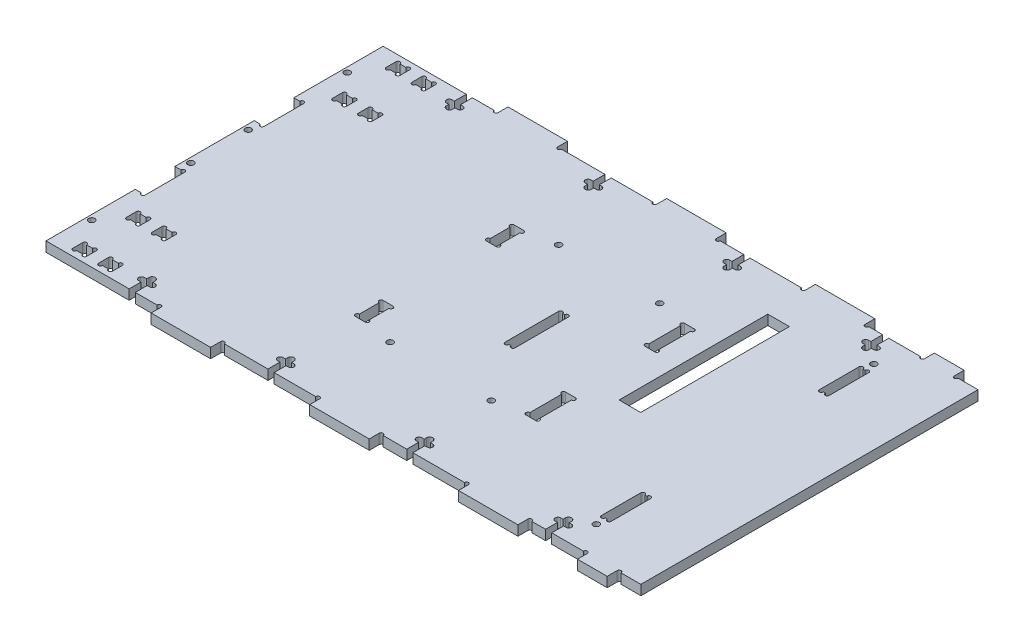
from build123d import *

# Parameters (mm, degrees)
SKETCH_1_W           = 300
SKETCH_1_H           = 170
EXTRUDE_1_DEPTH      = 5
SKETCH_2_W           = 5
SKETCH_2_H           = 27
SKETCH_2_H_2         = 20
CUT_EXTRUDE_1_DEPTH  = 10
SKETCH_3_R           = 1.55
CUT_EXTRUDE_2_DEPTH  = 10
SKETCH_4_W           = 5
SKETCH_4_H           = 20
CUT_EXTRUDE_3_DEPTH  = 5
SKETCH_5_R           = 1
CUT_EXTRUDE_4_DEPTH  = 10
SKETCH_8_W           = 30
SKETCH_8_H           = 5
SKETCH_8_W_2         = 15
EXTRUDE_2_DEPTH      = 5
SKETCH_9_R           = 1
CUT_EXTRUDE_6_DEPTH  = 5
SKETCH_13_W          = 7
SKETCH_13_H          = 5
CUT_EXTRUDE_9_DEPTH  = 10
SKETCH_14_R          = 1
CUT_EXTRUDE_10_DEPTH = 10
SKETCH_15_W          = 5
SKETCH_15_H          = 14
SKETCH_15_H_2        = 20
CUT_EXTRUDE_11_DEPTH = 10
SKETCH_16_R          = 1
CUT_EXTRUDE_12_DEPTH = 10
SKETCH_17_W          = 10.9
SKETCH_17_H          = 75
CUT_EXTRUDE_13_DEPTH = 10
CUT_EXTRUDE_5_DEPTH  = 10


with BuildPart() as part:
    # 스케치1 → 보스-돌출1 (new body)
    with BuildSketch(Plane(origin=(0, 0, 0), x_dir=(1, 0, 0), z_dir=(0, 1, 0))):
        with Locations((150, 85)):
            Rectangle(SKETCH_1_W, SKETCH_1_H)
    extrude(amount=EXTRUDE_1_DEPTH)

    # 스케치2 → 컷-돌출1 (cut)
    with BuildSketch(Plane.XZ):
        with Locations((162.5, -85)):
            Rectangle(SKETCH_2_W, SKETCH_2_H)
        with Locations((262.5, -30)):
            Rectangle(SKETCH_2_W, SKETCH_2_H_2)
        with Locations((262.5, -140)):
            Rectangle(SKETCH_2_W, SKETCH_2_H_2)
    extrude(amount=-CUT_EXTRUDE_1_DEPTH, mode=Mode.SUBTRACT)

    # 스케치3 → 컷-돌출2 (cut)
    with BuildSketch(Plane(origin=(0, 5, 0), x_dir=(1, 0, 0), z_dir=(0, 1, 0))):
        with Locations((131, 127.5)):
            Circle(SKETCH_3_R)
        with Locations((182, 127.5)):
            Circle(SKETCH_3_R)
        with Locations((182, 42.5)):
            Circle(SKETCH_3_R)
        with Locations((131, 42.5)):
            Circle(SKETCH_3_R)
        with Locations((2.5, 70.55)):
            Circle(SKETCH_3_R)
        with Locations((2.5, 20.55)):
            Circle(SKETCH_3_R)
        with Locations((2.5, 99.45)):
            Circle(SKETCH_3_R)
        with Locations((2.5, 149.45)):
            Circle(SKETCH_3_R)
        with Locations((262.5, 155)):
            Circle(SKETCH_3_R)
        with Locations((262.5, 15)):
            Circle(SKETCH_3_R)
    extrude(amount=-CUT_EXTRUDE_2_DEPTH, mode=Mode.SUBTRACT)

    # 스케치4 → 컷-돌출3 (cut)
    with BuildSketch(Plane.XZ):
        with Locations((2.5, -115)):
            Rectangle(SKETCH_4_W, SKETCH_4_H)
        with Locations((2.5, -55)):
            Rectangle(SKETCH_4_W, SKETCH_4_H)
    extrude(amount=-CUT_EXTRUDE_3_DEPTH, mode=Mode.SUBTRACT)

    # 스케치5 → 컷-돌출4 (cut)
    with BuildSketch(Plane.XZ):
        with Locations((4, -45)):
            Circle(SKETCH_5_R)
        with Locations((4, -65)):
            Circle(SKETCH_5_R)
        with Locations((4, -105)):
            Circle(SKETCH_5_R)
        with Locations((4, -125)):
            Circle(SKETCH_5_R)
        with Locations((164, -98.5)):
            Circle(SKETCH_5_R)
        with Locations((161, -98.5)):
            Circle(SKETCH_5_R)
        with Locations((164, -71.5)):
            Circle(SKETCH_5_R)
        with Locations((161, -71.5)):
            Circle(SKETCH_5_R)
        with Locations((264, -20)):
            Circle(SKETCH_5_R)
        with Locations((261, -20)):
            Circle(SKETCH_5_R)
        with Locations((264, -40)):
            Circle(SKETCH_5_R)
        with Locations((261, -40)):
            Circle(SKETCH_5_R)
        with Locations((264, -130)):
            Circle(SKETCH_5_R)
        with Locations((261, -130)):
            Circle(SKETCH_5_R)
        with Locations((264, -150)):
            Circle(SKETCH_5_R)
        with Locations((261, -150)):
            Circle(SKETCH_5_R)
    extrude(amount=-CUT_EXTRUDE_4_DEPTH, mode=Mode.SUBTRACT)

    # 스케치8 → 보스-돌출2 (add)
    with BuildSketch(Plane.XZ):
        with Locations((73, 2.5)):
            Rectangle(SKETCH_8_W, SKETCH_8_H)
        with Locations((153, 2.5)):
            Rectangle(SKETCH_8_W, SKETCH_8_H)
        with Locations((228, 2.5)):
            Rectangle(SKETCH_8_W, SKETCH_8_H)
        with Locations((280.5, 2.5)):
            Rectangle(SKETCH_8_W_2, SKETCH_8_H)
        with Locations((280.5, -172.5)):
            Rectangle(SKETCH_8_W_2, SKETCH_8_H)
        with Locations((228, -172.5)):
            Rectangle(SKETCH_8_W, SKETCH_8_H)
        with Locations((153, -172.5)):
            Rectangle(SKETCH_8_W, SKETCH_8_H)
        with Locations((73, -172.5)):
            Rectangle(SKETCH_8_W, SKETCH_8_H)
    extrude(amount=-EXTRUDE_2_DEPTH)

    # 스케치9 → 컷-돌출6 (cut)
    with BuildSketch(Plane.XZ):
        with Locations((57, 0)):
            Circle(SKETCH_9_R)
        with Locations((89, 0)):
            Circle(SKETCH_9_R)
        with Locations((137, 0)):
            Circle(SKETCH_9_R)
        with Locations((169, 0)):
            Circle(SKETCH_9_R)
        with Locations((212, 0)):
            Circle(SKETCH_9_R)
        with Locations((272, 0)):
            Circle(SKETCH_9_R)
        with Locations((244, 0)):
            Circle(SKETCH_9_R)
        with Locations((289, 0)):
            Circle(SKETCH_9_R)
        with Locations((289, -170)):
            Circle(SKETCH_9_R)
        with Locations((244, -170)):
            Circle(SKETCH_9_R)
        with Locations((272, -170)):
            Circle(SKETCH_9_R)
        with Locations((212, -170)):
            Circle(SKETCH_9_R)
        with Locations((169, -170)):
            Circle(SKETCH_9_R)
        with Locations((137, -170)):
            Circle(SKETCH_9_R)
        with Locations((89, -170)):
            Circle(SKETCH_9_R)
        with Locations((57, -170)):
            Circle(SKETCH_9_R)
    extrude(amount=-CUT_EXTRUDE_6_DEPTH, mode=Mode.SUBTRACT)

    # 스케치13 → 컷-돌출9 (cut)
    with BuildSketch(Plane(origin=(0, 5, 0), x_dir=(1, 0, 0), z_dir=(0, 1, 0))):
        with Locations((26.5, 6)):
            Rectangle(SKETCH_13_W, SKETCH_13_H)
        with Locations((13.5, 6)):
            Rectangle(SKETCH_13_W, SKETCH_13_H)
        with Locations((13.5, 33)):
            Rectangle(SKETCH_13_W, SKETCH_13_H)
        with Locations((26.5, 33)):
            Rectangle(SKETCH_13_W, SKETCH_13_H)
        with Locations((26.5, 137)):
            Rectangle(SKETCH_13_W, SKETCH_13_H)
        with Locations((13.5, 137)):
            Rectangle(SKETCH_13_W, SKETCH_13_H)
        with Locations((13.5, 164)):
            Rectangle(SKETCH_13_W, SKETCH_13_H)
        with Locations((26.5, 164)):
            Rectangle(SKETCH_13_W, SKETCH_13_H)
    extrude(amount=-CUT_EXTRUDE_9_DEPTH, mode=Mode.SUBTRACT)

    # 스케치14 → 컷-돌출10 (cut)
    with BuildSketch(Plane.XZ):
        with Locations((11, -8.5)):
            Circle(SKETCH_14_R)
        with Locations((11, -3.5)):
            Circle(SKETCH_14_R)
        with Locations((16, -3.5)):
            Circle(SKETCH_14_R)
        with Locations((16, -8.5)):
            Circle(SKETCH_14_R)
        with Locations((24, -8.5)):
            Circle(SKETCH_14_R)
        with Locations((24, -3.5)):
            Circle(SKETCH_14_R)
        with Locations((29, -3.5)):
            Circle(SKETCH_14_R)
        with Locations((29, -8.5)):
            Circle(SKETCH_14_R)
        with Locations((29, -30.5)):
            Circle(SKETCH_14_R)
        with Locations((29, -35.5)):
            Circle(SKETCH_14_R)
        with Locations((24, -35.5)):
            Circle(SKETCH_14_R)
        with Locations((24, -30.5)):
            Circle(SKETCH_14_R)
        with Locations((16, -30.5)):
            Circle(SKETCH_14_R)
        with Locations((16, -35.5)):
            Circle(SKETCH_14_R)
        with Locations((11, -35.5)):
            Circle(SKETCH_14_R)
        with Locations((11, -30.5)):
            Circle(SKETCH_14_R)
        with Locations((11, -139.5)):
            Circle(SKETCH_14_R)
        with Locations((11, -134.5)):
            Circle(SKETCH_14_R)
        with Locations((16, -134.5)):
            Circle(SKETCH_14_R)
        with Locations((16, -139.5)):
            Circle(SKETCH_14_R)
        with Locations((24, -139.5)):
            Circle(SKETCH_14_R)
        with Locations((24, -134.5)):
            Circle(SKETCH_14_R)
        with Locations((29, -134.5)):
            Circle(SKETCH_14_R)
        with Locations((29, -139.5)):
            Circle(SKETCH_14_R)
        with Locations((29, -161.5)):
            Circle(SKETCH_14_R)
        with Locations((29, -166.5)):
            Circle(SKETCH_14_R)
        with Locations((24, -166.5)):
            Circle(SKETCH_14_R)
        with Locations((24, -161.5)):
            Circle(SKETCH_14_R)
        with Locations((16, -161.5)):
            Circle(SKETCH_14_R)
        with Locations((16, -166.5)):
            Circle(SKETCH_14_R)
        with Locations((11, -166.5)):
            Circle(SKETCH_14_R)
        with Locations((11, -161.5)):
            Circle(SKETCH_14_R)
    extrude(amount=-CUT_EXTRUDE_10_DEPTH, mode=Mode.SUBTRACT)

    # 스케치15 → 컷-돌출11 (cut)
    with BuildSketch(Plane(origin=(0, 5, 0), x_dir=(1, 0, 0), z_dir=(0, 1, 0))):
        with Locations((113.5, 118)):
            Rectangle(SKETCH_15_W, SKETCH_15_H)
        with Locations((113.5, 52)):
            Rectangle(SKETCH_15_W, SKETCH_15_H)
        with Locations((199.5, 55)):
            Rectangle(SKETCH_15_W, SKETCH_15_H_2)
        with Locations((199.5, 115)):
            Rectangle(SKETCH_15_W, SKETCH_15_H_2)
    extrude(amount=-CUT_EXTRUDE_11_DEPTH, mode=Mode.SUBTRACT)

    # 스케치16 → 컷-돌출12 (cut)
    with BuildSketch(Plane(origin=(0, 5, 0), x_dir=(1, 0, 0), z_dir=(0, 1, 0))):
        with Locations((111, 46)):
            Circle(SKETCH_16_R)
        with Locations((116, 46)):
            Circle(SKETCH_16_R)
        with Locations((116, 58)):
            Circle(SKETCH_16_R)
        with Locations((111, 58)):
            Circle(SKETCH_16_R)
        with Locations((111, 112)):
            Circle(SKETCH_16_R)
        with Locations((116, 112)):
            Circle(SKETCH_16_R)
        with Locations((116, 124)):
            Circle(SKETCH_16_R)
        with Locations((111, 124)):
            Circle(SKETCH_16_R)
        with Locations((202, 124)):
            Circle(SKETCH_16_R)
        with Locations((197, 124)):
            Circle(SKETCH_16_R)
        with Locations((197, 64)):
            Circle(SKETCH_16_R)
        with Locations((202, 64)):
            Circle(SKETCH_16_R)
        with Locations((202, 106)):
            Circle(SKETCH_16_R)
        with Locations((197, 106)):
            Circle(SKETCH_16_R)
        with Locations((197, 46)):
            Circle(SKETCH_16_R)
        with Locations((202, 46)):
            Circle(SKETCH_16_R)
    extrude(amount=-CUT_EXTRUDE_12_DEPTH, mode=Mode.SUBTRACT)

    # 스케치17 → 컷-돌출13 (cut)
    with BuildSketch(Plane(origin=(0, 5, 0), x_dir=(1, 0, 0), z_dir=(0, 1, 0))):
        with Locations((219.45, 112.5)):
            Rectangle(SKETCH_17_W, SKETCH_17_H)
    extrude(amount=-CUT_EXTRUDE_13_DEPTH, mode=Mode.SUBTRACT)

    # 스케치7 → 컷-돌출5 (cut)
    with BuildSketch(Plane.XZ):
        with BuildLine():
            Line((115.028741621, -170), (111.928741621, -170))
            Line((111.928741621, -170), (111.928741621, -164))
            Line((111.928741621, -164), (110.728741621, -164))
            ThreePointArc((110.728741621, -164), (109.328741621, -162.6), (110.728741621, -161.2))
            Line((110.728741621, -161.2), (111.928741621, -161.2))
            Line((111.928741621, -161.2), (111.928741621, -160))
            ThreePointArc((111.928741621, -160), (113.478741621, -158.45), (115.028741621, -160))
            Line((115.028741621, -160), (115.028741621, -161.2))
            Line((115.028741621, -161.2), (116.228741621, -161.2))
            ThreePointArc((116.228741621, -161.2), (117.628741621, -162.6), (116.228741621, -164))
            Line((116.228741621, -164), (115.028741621, -164))
            Line((115.028741621, -164), (115.028741621, -170))
        make_face()
        with BuildLine():
            Line((185.028741621, -170), (181.928741621, -170))
            Line((181.928741621, -170), (181.928741621, -164))
            Line((181.928741621, -164), (180.728741621, -164))
            ThreePointArc((180.728741621, -164), (179.328741621, -162.6), (180.728741621, -161.2))
            Line((180.728741621, -161.2), (181.928741621, -161.2))
            Line((181.928741621, -161.2), (181.928741621, -160))
            ThreePointArc((181.928741621, -160), (183.478741621, -158.45), (185.028741621, -160))
            Line((185.028741621, -160), (185.028741621, -161.2))
            Line((185.028741621, -161.2), (186.228741621, -161.2))
            ThreePointArc((186.228741621, -161.2), (187.628741621, -162.6), (186.228741621, -164))
            Line((186.228741621, -164), (185.028741621, -164))
            Line((185.028741621, -164), (185.028741621, -170))
        make_face()
        with BuildLine():
            Line((255.028741621, -170), (251.928741621, -170))
            Line((251.928741621, -170), (251.928741621, -164))
            Line((251.928741621, -164), (250.728741621, -164))
            ThreePointArc((250.728741621, -164), (249.328741621, -162.6), (250.728741621, -161.2))
            Line((250.728741621, -161.2), (251.928741621, -161.2))
            Line((251.928741621, -161.2), (251.928741621, -160))
            ThreePointArc((251.928741621, -160), (253.478741621, -158.45), (255.028741621, -160))
            Line((255.028741621, -160), (255.028741621, -161.2))
            Line((255.028741621, -161.2), (256.228741621, -161.2))
            ThreePointArc((256.228741621, -161.2), (257.628741621, -162.6), (256.228741621, -164))
            Line((256.228741621, -164), (255.028741621, -164))
            Line((255.028741621, -164), (255.028741621, -170))
        make_face()
        with BuildLine():
            Line((46.228741621, -8.8), (45.028741621, -8.8))
            Line((45.028741621, -8.8), (45.028741621, -10))
            ThreePointArc((45.028741621, -10), (43.478741621, -11.55), (41.928741621, -10))
            Line((41.928741621, -10), (41.928741621, -8.8))
            Line((41.928741621, -8.8), (40.728741621, -8.8))
            ThreePointArc((40.728741621, -8.8), (39.328741621, -7.4), (40.728741621, -6))
            Line((40.728741621, -6), (41.928741621, -6))
            Line((41.928741621, -6), (41.928741621, 0))
            Line((41.928741621, 0), (45.028741621, 0))
            Line((45.028741621, 0), (45.028741621, -6))
            Line((45.028741621, -6), (46.228741621, -6))
            ThreePointArc((46.228741621, -6), (47.628741621, -7.4), (46.228741621, -8.8))
        make_face()
        with BuildLine():
            Line((45.028741621, -170), (41.928741621, -170))
            Line((41.928741621, -170), (41.928741621, -164))
            Line((41.928741621, -164), (40.728741621, -164))
            ThreePointArc((40.728741621, -164), (39.328741621, -162.6), (40.728741621, -161.2))
            Line((40.728741621, -161.2), (41.928741621, -161.2))
            Line((41.928741621, -161.2), (41.928741621, -160))
            ThreePointArc((41.928741621, -160), (43.478741621, -158.45), (45.028741621, -160))
            Line((45.028741621, -160), (45.028741621, -161.2))
            Line((45.028741621, -161.2), (46.228741621, -161.2))
            ThreePointArc((46.228741621, -161.2), (47.628741621, -162.6), (46.228741621, -164))
            Line((46.228741621, -164), (45.028741621, -164))
            Line((45.028741621, -164), (45.028741621, -170))
        make_face()
        with BuildLine():
            Line((256.228741621, -8.8), (255.028741621, -8.8))
            Line((255.028741621, -8.8), (255.028741621, -10))
            ThreePointArc((255.028741621, -10), (253.478741621, -11.55), (251.928741621, -10))
            Line((251.928741621, -10), (251.928741621, -8.8))
            Line((251.928741621, -8.8), (250.728741621, -8.8))
            ThreePointArc((250.728741621, -8.8), (249.328741621, -7.4), (250.728741621, -6))
            Line((250.728741621, -6), (251.928741621, -6))
            Line((251.928741621, -6), (251.928741621, 0))
            Line((251.928741621, 0), (255.028741621, 0))
            Line((255.028741621, 0), (255.028741621, -6))
            Line((255.028741621, -6), (256.228741621, -6))
            ThreePointArc((256.228741621, -6), (257.628741621, -7.4), (256.228741621, -8.8))
        make_face()
        with BuildLine():
            Line((186.228741621, -8.8), (185.028741621, -8.8))
            Line((185.028741621, -8.8), (185.028741621, -10))
            ThreePointArc((185.028741621, -10), (183.478741621, -11.55), (181.928741621, -10))
            Line((181.928741621, -10), (181.928741621, -8.8))
            Line((181.928741621, -8.8), (180.728741621, -8.8))
            ThreePointArc((180.728741621, -8.8), (179.328741621, -7.4), (180.728741621, -6))
            Line((180.728741621, -6), (181.928741621, -6))
            Line((181.928741621, -6), (181.928741621, 0))
            Line((181.928741621, 0), (185.028741621, 0))
            Line((185.028741621, 0), (185.028741621, -6))
            Line((185.028741621, -6), (186.228741621, -6))
            ThreePointArc((186.228741621, -6), (187.628741621, -7.4), (186.228741621, -8.8))
        make_face()
        with BuildLine():
            Line((116.228741621, -8.8), (115.028741621, -8.8))
            Line((115.028741621, -8.8), (115.028741621, -10))
            ThreePointArc((115.028741621, -10), (113.478741621, -11.55), (111.928741621, -10))
            Line((111.928741621, -10), (111.928741621, -8.8))
            Line((111.928741621, -8.8), (110.728741621, -8.8))
            ThreePointArc((110.728741621, -8.8), (109.328741621, -7.4), (110.728741621, -6))
            Line((110.728741621, -6), (111.928741621, -6))
            Line((111.928741621, -6), (111.928741621, 0))
            Line((111.928741621, 0), (115.028741621, 0))
            Line((115.028741621, 0), (115.028741621, -6))
            Line((115.028741621, -6), (116.228741621, -6))
            ThreePointArc((116.228741621, -6), (117.628741621, -7.4), (116.228741621, -8.8))
        make_face()
    extrude(amount=-CUT_EXTRUDE_5_DEPTH, mode=Mode.SUBTRACT)


solid = part.part
